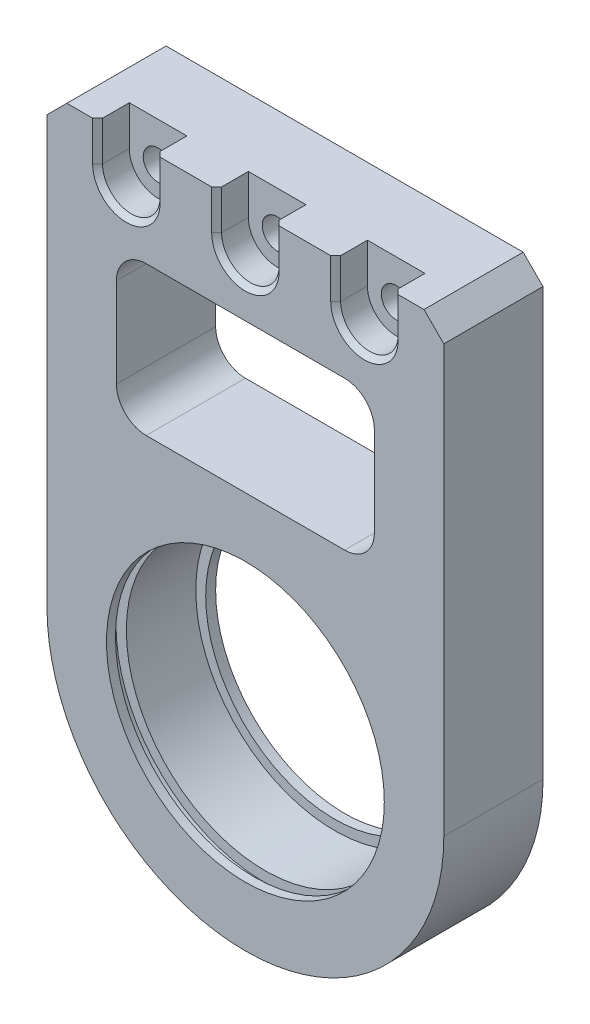
from build123d import *

# Parameters (mm, degrees)
SKETCH_1_W          = 40
SKETCH_1_H          = 65
EXTRUDE_1_DEPTH     = 10
SKETCH_2_R          = 14
CUT_EXTRUDE_1_DEPTH = 12
SKETCH_3_R          = 15.05
CUT_EXTRUDE_2_DEPTH = 1.1
CHAMFER_1_SIZE      = 2
FILLET_1_R          = 20
SKETCH_4_R          = 1.5
CUT_EXTRUDE_3_DEPTH = 15
SKETCH_5_W          = 26
SKETCH_5_H          = 15
CUT_EXTRUDE_4_DEPTH = 15
FILLET_2_R          = 3
EXTRUDE_START       = -1
SKETCH_7_R          = 14
SKETCH_7_R_2        = 13
EXTRUDE_2_DEPTH     = 1
CUT_EXTRUDE_5_DEPTH = 3.2
CHAMFER_2_SIZE      = 0.5


with BuildPart() as part:
    # 草图1 → 凸台-拉伸1 (new body)
    with BuildSketch(Plane.XY):
        with Locations((20, -37.5)):
            Rectangle(SKETCH_1_W, SKETCH_1_H)
    extrude(amount=EXTRUDE_1_DEPTH)

    # 草图2 → 切除-拉伸1 (cut)
    with BuildSketch(Plane.XY.offset(10)):
        with Locations((20, -50)):
            Circle(SKETCH_2_R)
    extrude(amount=-CUT_EXTRUDE_1_DEPTH, mode=Mode.SUBTRACT)

    # 草图3 → 切除-拉伸2 (cut)
    with BuildSketch(Plane(origin=(0, 0, 8), x_dir=(-1, 0, 0), z_dir=(0, 0, -1))):
        with Locations((-20, -50)):
            Circle(SKETCH_3_R)
    extrude(amount=-CUT_EXTRUDE_2_DEPTH, mode=Mode.SUBTRACT)

    # 倒角1
    chamfer_1_edges = [part.edges().sort_by_distance(p)[0] for p in [
        (0, -5, 5),
        (40, -5, 5),
    ]]
    chamfer(chamfer_1_edges, length=CHAMFER_1_SIZE)

    # 圆角1
    fillet_1_edges = [part.edges().sort_by_distance(p)[0] for p in [
        (0, -70, 5),
        (40, -70, 5),
    ]]
    fillet(fillet_1_edges, radius=FILLET_1_R - 0.0001)  # a hair under: the kernel refuses the full size

    # 草图4 → 切除-拉伸3 (cut)
    with BuildSketch(Plane(origin=(0, 0, 0), x_dir=(-1, 0, 0), z_dir=(0, 0, -1))):
        with Locations((-32, -9)):
            Circle(SKETCH_4_R)
        with Locations((-20, -9)):
            Circle(SKETCH_4_R)
        with Locations((-8, -9)):
            Circle(SKETCH_4_R)
    extrude(amount=-CUT_EXTRUDE_3_DEPTH, mode=Mode.SUBTRACT)

    # 草图5 → 切除-拉伸4 (cut)
    with BuildSketch(Plane(origin=(0, 0, 0), x_dir=(-1, 0, 0), z_dir=(0, 0, -1))):
        with Locations((-20, -22.5)):
            Rectangle(SKETCH_5_W, SKETCH_5_H)
    extrude(amount=-CUT_EXTRUDE_4_DEPTH, mode=Mode.SUBTRACT)

    # 圆角2
    fillet_2_edges = [part.edges().sort_by_distance(p)[0] for p in [
        (7, -15, 5),
        (7, -30, 5),
        (33, -30, 5),
        (33, -15, 5),
    ]]
    fillet(fillet_2_edges, radius=FILLET_2_R)

    # 草图7 → 凸台-拉伸2 (add)
    with BuildSketch(Plane(origin=(0, 0, 0), x_dir=(-1, 0, 0), z_dir=(0, 0, -1)).offset(EXTRUDE_START)):
        with Locations((-20, -50)):
            Circle(SKETCH_7_R)
        with Locations((-20, -50)):
            Circle(SKETCH_7_R_2, mode=Mode.SUBTRACT)
    extrude(amount=EXTRUDE_2_DEPTH)

    # 草图8 → 切除-拉伸5 (cut)
    with BuildSketch(Plane.XY.offset(10)):
        with BuildLine():
            Line((5.1, -9), (5.1, -5))
            Line((5.1, -5), (10.9, -5))
            Line((10.9, -5), (10.9, -9))
            ThreePointArc((10.9, -9), (8, -11.9), (5.1, -9))
        make_face()
        with BuildLine():
            Line((17.1, -9), (17.1, -5))
            Line((17.1, -5), (22.9, -5))
            Line((22.9, -5), (22.9, -9))
            ThreePointArc((22.9, -9), (20, -11.9), (17.1, -9))
        make_face()
        with BuildLine():
            Line((34.9, -9), (34.9, -5))
            Line((34.9, -5), (29.1, -5))
            Line((29.1, -5), (29.1, -9))
            ThreePointArc((29.1, -9), (32, -11.9), (34.9, -9))
        make_face()
    extrude(amount=-CUT_EXTRUDE_5_DEPTH, mode=Mode.SUBTRACT)

    # 倒角2
    chamfer_2_edges = [part.edges().sort_by_distance(p)[0] for p in [
        (8, -11.9, 10),
        (10.9, -7, 10),
        (5.1, -7, 10),
        (32, -11.9, 10),
        (34.9, -7, 10),
        (29.1, -7, 10),
        (20, -11.9, 10),
        (22.9, -7, 10),
        (17.1, -7, 10),
    ]]
    chamfer(chamfer_2_edges, length=CHAMFER_2_SIZE)


solid = part.part
